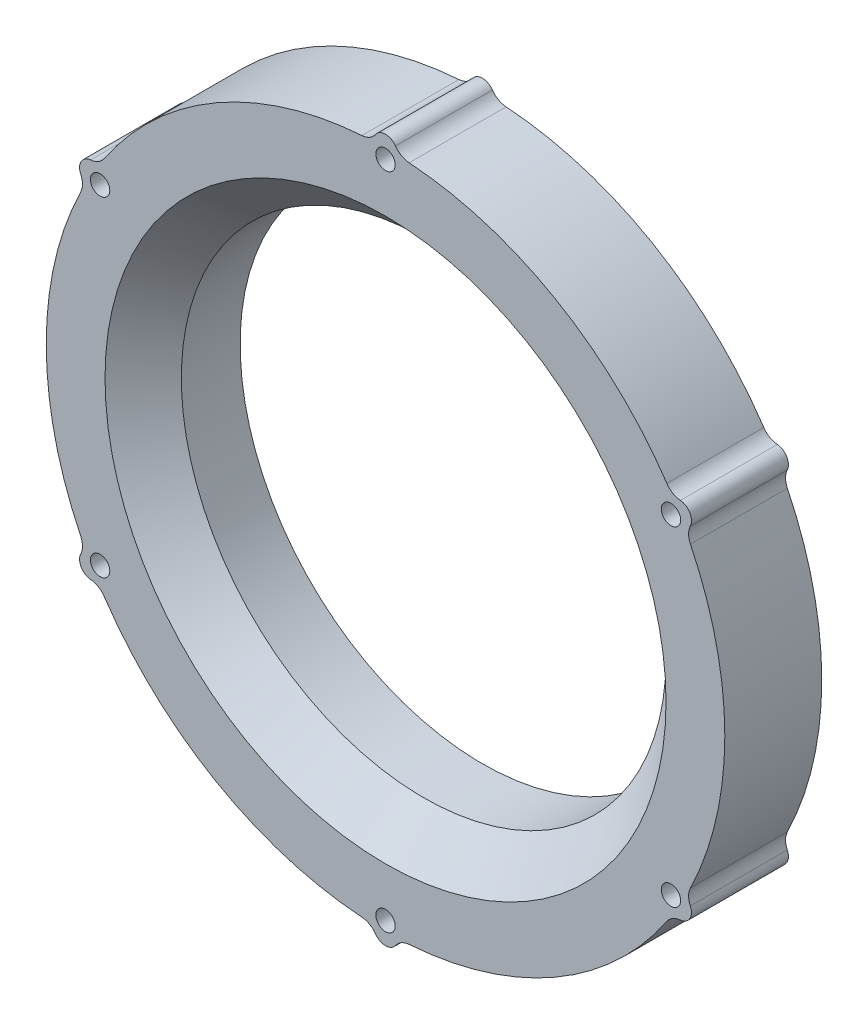
from build123d import *

# Parameters (mm, degrees)
SKETCH1_R           = 63.5
BOSS_EXTRUDE1_DEPTH = 25.4
CHAMFER1_SIZE       = 10
SKETCH3_R           = 2.54
CUT_EXTRUDE1_DEPTH  = 131.484388434
FILLET1_R           = 4.7625


with BuildPart() as part:
    # Sketch1 → Boss-Extrude1 (new body)
    with BuildSketch(Plane.XY):
        with BuildLine():
            ThreePointArc((78.52780472, -41.672459561), (88.9, 0), (78.52780472, 41.672459561))
            ThreePointArc((78.52780472, 41.672459561), (79.739289053, 46.0375), (75.353310978, 47.17084401))
            ThreePointArc((75.353310978, 47.17084401), (44.45, 76.989658396), (3.174493742, 88.843303571))
            ThreePointArc((3.174493742, 88.843303571), (0, 92.075), (-3.174493742, 88.843303571))
            ThreePointArc((-3.174493742, 88.843303571), (-44.45, 76.989658396), (-75.353310978, 47.17084401))
            ThreePointArc((-75.353310978, 47.17084401), (-79.739289053, 46.0375), (-78.52780472, 41.672459561))
            ThreePointArc((-78.52780472, 41.672459561), (-88.9, 0), (-78.52780472, -41.672459561))
            ThreePointArc((-78.52780472, -41.672459561), (-79.739289053, -46.0375), (-75.353310978, -47.17084401))
            ThreePointArc((-75.353310978, -47.17084401), (-44.45, -76.989658396), (-3.174493742, -88.843303571))
            ThreePointArc((-3.174493742, -88.843303571), (0, -92.075), (3.174493742, -88.843303571))
            ThreePointArc((3.174493742, -88.843303571), (44.45, -76.989658396), (75.353310978, -47.17084401))
            ThreePointArc((75.353310978, -47.17084401), (79.739289053, -46.0375), (78.52780472, -41.672459561))
        make_face()
        Circle(SKETCH1_R, mode=Mode.SUBTRACT)
    extrude(amount=BOSS_EXTRUDE1_DEPTH)

    # Chamfer1
    chamfer1_edges = [part.edges().sort_by_distance(p)[0] for p in [
        (-63.5, 0, 25.4),
    ]]
    chamfer(chamfer1_edges, length=CHAMFER1_SIZE)

    # Sketch3 → Cut-Extrude1 (cut, through all)
    with BuildSketch(Plane.XY.offset(25.4)):
        with Locations((74.789953871, 43.18)):
            Circle(SKETCH3_R)
        with Locations((74.789953871, -43.18)):
            Circle(SKETCH3_R)
        with Locations((0, 86.36)):
            Circle(SKETCH3_R)
        with Locations((0, -86.36)):
            Circle(SKETCH3_R)
        with Locations((-74.789953871, 43.18)):
            Circle(SKETCH3_R)
        with Locations((-74.789953871, -43.18)):
            Circle(SKETCH3_R)
    extrude(amount=-CUT_EXTRUDE1_DEPTH, mode=Mode.SUBTRACT)

    # Fillet1
    fillet1_edges = [part.edges().sort_by_distance(p)[0] for p in [
        (75.353310978, 47.17084401, 12.7),
        (78.52780472, 41.672459561, 12.7),
        (78.52780472, -41.672459561, 12.7),
        (75.353310978, -47.17084401, 12.7),
        (3.174493742, -88.843303571, 12.7),
        (-3.174493742, -88.843303571, 12.7),
        (-75.353310978, -47.17084401, 12.7),
        (-78.52780472, -41.672459561, 12.7),
        (-78.52780472, 41.672459561, 12.7),
        (-75.353310978, 47.17084401, 12.7),
        (-3.174493742, 88.843303571, 12.7),
        (3.174493742, 88.843303571, 12.7),
    ]]
    fillet(fillet1_edges, radius=FILLET1_R)


solid = part.part
